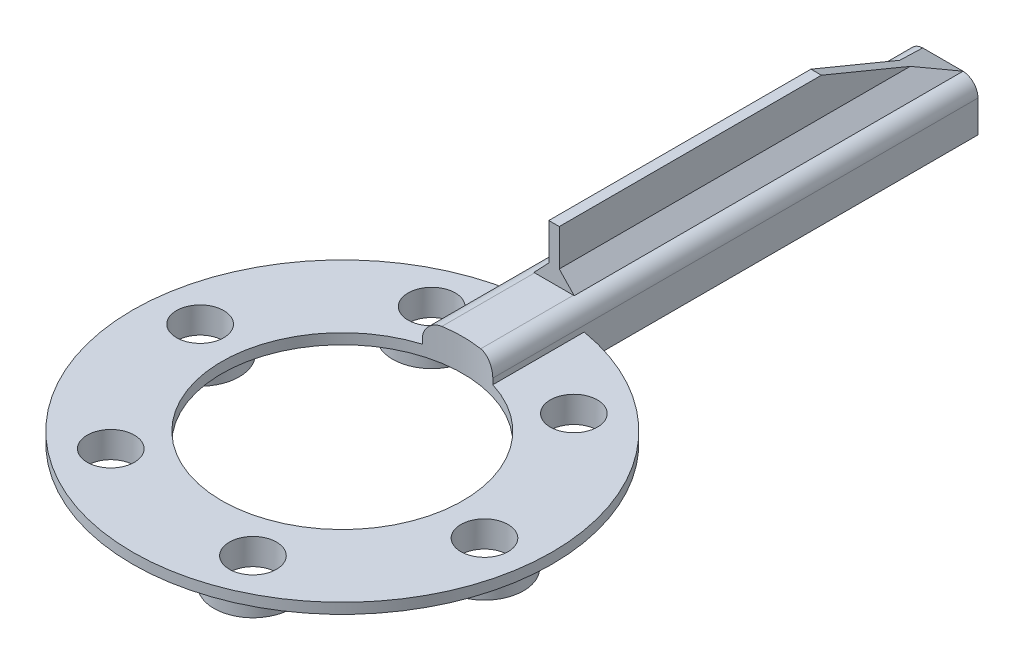
from build123d import *

# Parameters (mm, degrees)
SKETCH1_R            = 40
SKETCH1_R_2          = 23
BOSS_EXTRUDE1_DEPTH  = 2
SKETCH2_R            = 7.446883929
SKETCH2_R_2          = 4.5
BOSS_EXTRUDE2_DEPTH  = 3
BOSS_EXTRUDE3_DEPTH  = 6.1
FILLET1_R            = 3
BOSS_EXTRUDE4_DEPTH  = 1
CHAMFER1_START       = -114.555494515
CHAMFER1_DEPTH       = 74.172546458
CHAMFER1_START_2     = 49.428104725
CHAMFER1_2_OUTLINE_W = 3
CHAMFER1_2_OUTLINE_H = 11
CHAMFER1_2_DEPTH     = 3.571895275
SKETCH6_R            = 4.5
CUT_EXTRUDE1_DEPTH   = 6
SKETCH7_W            = 13.4
SKETCH7_H            = 75.12061148
BOSS_EXTRUDE5_DEPTH  = 3


with BuildPart() as part:
    # Sketch1 → Boss-Extrude1 (new body)
    with BuildSketch(Plane(origin=(0, 0, 0), x_dir=(1, 0, 0), z_dir=(0, 1, 0))):
        with Locations(Location((0, 0, 0), (0, 0, 270))):
            Circle(SKETCH1_R)
        with Locations(Location((0, 0, 0), (0, 0, 270))):
            Circle(SKETCH1_R_2, mode=Mode.SUBTRACT)
    extrude(amount=BOSS_EXTRUDE1_DEPTH)

    # Sketch2 → Boss-Extrude2 (add)
    # profile 1 of 6: a face of its own
    with BuildSketch(Plane.XZ):
        with Locations(Location((12.054528119, 29.102205274, 0), (0, 0, 90))):
            Circle(SKETCH2_R)
        with Locations(Location((12.054528119, 29.102205274, 0), (0, 0, 270))):
            Circle(SKETCH2_R_2, mode=Mode.SUBTRACT)
    # profile 2 of 6: a face of its own
    with BuildSketch(Plane.XZ):
        with Locations(Location((-19.175985014, 24.990630219, 0), (0, 0, 90))):
            Circle(SKETCH2_R)
        with Locations(Location((-19.175985014, 24.990630219, 0), (0, 0, 270))):
            Circle(SKETCH2_R_2, mode=Mode.SUBTRACT)
    # profile 3 of 6: a face of its own
    with BuildSketch(Plane.XZ):
        with Locations(Location((31.230513133, 4.111575055, 0), (0, 0, 90))):
            Circle(SKETCH2_R)
        with Locations(Location((31.230513133, 4.111575055, 0), (0, 0, 270))):
            Circle(SKETCH2_R_2, mode=Mode.SUBTRACT)
    # profile 4 of 6: a face of its own
    with BuildSketch(Plane.XZ):
        with Locations(Location((19.175985014, -24.990630219, 0), (0, 0, 90))):
            Circle(SKETCH2_R)
        with Locations(Location((19.175985014, -24.990630219, 0), (0, 0, 270))):
            Circle(SKETCH2_R_2, mode=Mode.SUBTRACT)
    # profile 5 of 6: a face of its own
    with BuildSketch(Plane.XZ):
        with Locations(Location((-12.05452812, -29.102205274, 0), (0, 0, 90))):
            Circle(SKETCH2_R)
        with Locations(Location((-12.05452812, -29.102205274, 0), (0, 0, 270))):
            Circle(SKETCH2_R_2, mode=Mode.SUBTRACT)
    # profile 6 of 6: a face of its own
    with BuildSketch(Plane.XZ):
        with Locations(Location((-31.230513133, -4.111575055, 0), (0, 0, 90))):
            Circle(SKETCH2_R)
        with Locations(Location((-31.230513133, -4.111575055, 0), (0, 0, 270))):
            Circle(SKETCH2_R_2, mode=Mode.SUBTRACT)
    extrude(amount=BOSS_EXTRUDE2_DEPTH)

    # Sketch3 → Boss-Extrude3 (add)
    with BuildSketch(Plane.XZ):
        with BuildLine():
            Line((-6.7, -87.315801531), (-6.7, -114.555494515))
            Line((-6.7, -114.555494515), (6.7, -114.555494515))
            Line((6.7, -114.555494515), (6.7, -87.315801531))
            Line((6.7, -87.315801531), (6.7, -37.501560575))
            Line((6.7, -37.501560575), (6.7, -22.002499858))
            ThreePointArc((6.7, -22.002499858), (0, -23), (-6.7, -22.002499858))
            Line((-6.7, -22.002499858), (-6.7, -37.501560575))
            Line((-6.7, -37.501560575), (-6.7, -87.315801531))
        make_face()
    extrude(amount=-BOSS_EXTRUDE3_DEPTH)

    # Fillet1
    fillet1_edges = [part.edges().sort_by_distance(p)[0] for p in [
        (6.7, 6.1, -68.278997186),
        (-6.7, 6.1, -68.278997186),
    ]]
    fillet(fillet1_edges, radius=FILLET1_R)

    # Sketch5 → Boss-Extrude4 (add, symmetric)
    with BuildSketch(Plane(origin=(0, 0, 0), x_dir=(0, 0, -1), z_dir=(1, 0, 0))):
        Polygon((40.382948057, 6.1), (40.382948057, 16.1), (90.382948057, 16.1), (114.555494515, 6.1), align=None)
    extrude(amount=BOSS_EXTRUDE4_DEPTH, both=True)

    # Chamfer1: read off the stored shape, not the designer's step
    # Chamfer1 outline → Chamfer1 (add)
    with BuildSketch(Plane.XY.offset(CHAMFER1_START)):
        with BuildLine():
            Line((-1, 6.1), (-1, 9.092495307))
            Line((-1, 9.092495307), (-3.85, 6.096247653))
            ThreePointArc((-3.85, 6.096247653), (-3.775023463, 6.099061767), (-3.7, 6.1))
            Line((-3.7, 6.1), (-1, 6.1))
        make_face()
        with BuildLine():
            Line((1, 9.092495307), (1, 6.1))
            Line((1, 6.1), (3.7, 6.1))
            ThreePointArc((3.7, 6.1), (3.775023463, 6.099061767), (3.85, 6.096247653))
            Line((3.85, 6.096247653), (1, 9.092495307))
        make_face()
    extrude(amount=CHAMFER1_DEPTH)

    # Chamfer1 2 outline → Chamfer1 2 (cut)
    with BuildSketch(Plane(origin=(0, 0, 0), x_dir=(1, 0, 0), z_dir=(0, 0.924049688522023, -0.382272380825966)).offset(CHAMFER1_START_2)):
        with Locations((2.5, 99.5)):
            Rectangle(CHAMFER1_2_OUTLINE_W, CHAMFER1_2_OUTLINE_H)
        with Locations((-2.5, 99.5)):
            Rectangle(CHAMFER1_2_OUTLINE_W, CHAMFER1_2_OUTLINE_H)
    extrude(amount=CHAMFER1_2_DEPTH, mode=Mode.SUBTRACT)

    # Sketch6 → Cut-Extrude1 (cut, symmetric)
    with BuildSketch(Plane.XZ):
        with Locations(Location((19.175985014, -24.990630219, 0), (0, 0, 90))):
            Circle(SKETCH6_R)
        with Locations(Location((-12.05452812, -29.102205274, 0), (0, 0, 90))):
            Circle(SKETCH6_R)
        with Locations(Location((-31.230513133, -4.111575055, 0), (0, 0, 90))):
            Circle(SKETCH6_R)
        with Locations(Location((-19.175985014, 24.990630219, 0), (0, 0, 90))):
            Circle(SKETCH6_R)
        with Locations(Location((12.05452812, 29.102205274, 0), (0, 0, 90))):
            Circle(SKETCH6_R)
        with Locations(Location((31.230513133, 4.111575055, 0), (0, 0, 90))):
            Circle(SKETCH6_R)
    extrude(amount=CUT_EXTRUDE1_DEPTH, both=True, mode=Mode.SUBTRACT)

    # Sketch7 → Boss-Extrude5 (add)
    with BuildSketch(Plane.XZ):
        with Locations((0, -76.995188775)):
            Rectangle(SKETCH7_W, SKETCH7_H)
    extrude(amount=BOSS_EXTRUDE5_DEPTH)


solid = part.part
